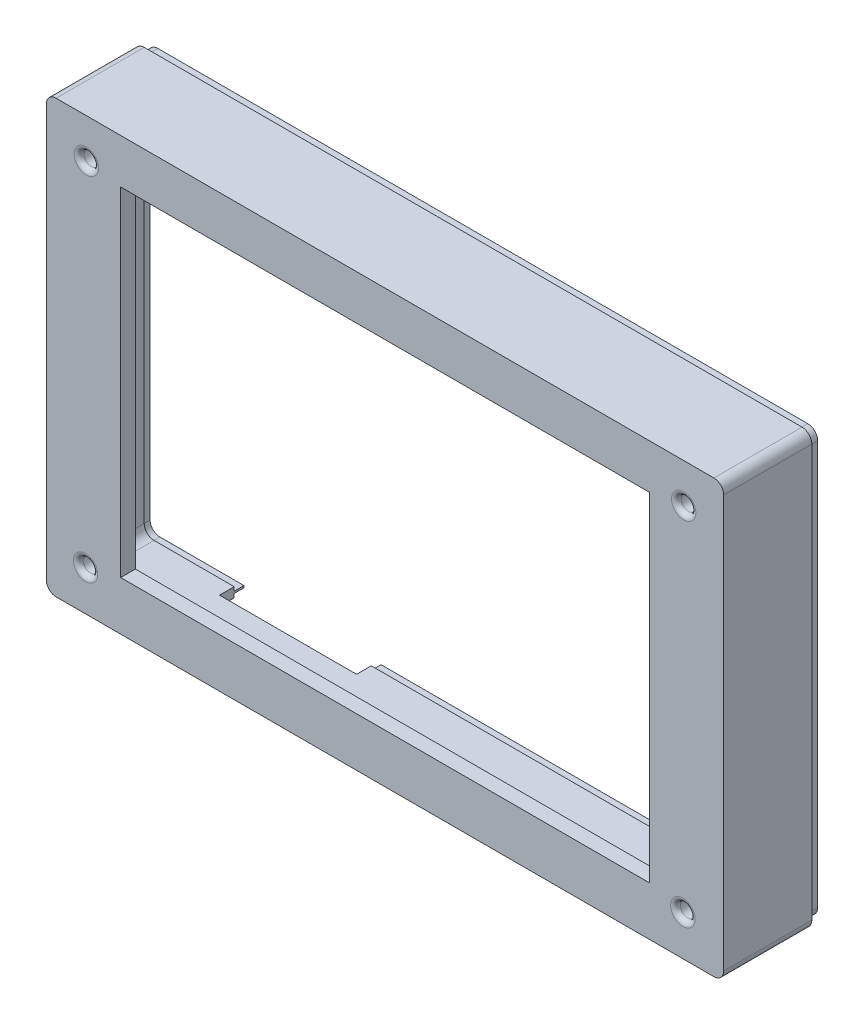
from build123d import *

# Parameters (mm, degrees)
SZKIC2_W                          = 138.377616904
SZKIC2_H                          = 88.232378654
SZKIC2_R                          = 1.492872888
SZKIC2_R_2                        = 1.482348965
SZKIC2_R_3                        = 1.507070184
SZKIC2_W_2                        = 108
SZKIC2_H_2                        = 69.098765565
DODANIE_WYCI_GNI_CIE1_DEPTH       = 3
SZKIC3_W                          = 138.377616904
SZKIC3_H                          = 88.232378654
SZKIC3_W_2                        = 134.377616904
SZKIC3_H_2                        = 84.232378654
WYCI_GNI_CIE_CIENKA_CIANKA1_DEPTH = 15
ZAOKR_GLENIE1_R                   = 1
DODANIE_WYCI_GNI_CIE2_START       = 1
SZKIC4_R                          = 2.492872888
SZKIC4_R_2                        = 1.492872888
SZKIC4_R_3                        = 2.507070184
SZKIC4_R_4                        = 1.507070184
SZKIC4_R_5                        = 2.482348965
SZKIC4_R_6                        = 1.482348965
DODANIE_WYCI_GNI_CIE2_DEPTH       = 1
ZAOKR_GLENIE2_R                   = 1
SZKIC5_W                          = 136.777616904
SZKIC5_H                          = 86.632378654
SZKIC5_W_2                        = 135.977616904
SZKIC5_H_2                        = 85.832378654
WYCI_GNI_CIE_CIENKA_CIANKA2_DEPTH = 2
ZAOKR_GLENIE3_R                   = 2
WYTNIJ_WYCI_GNI_CIE1_START        = 12
SZKIC6_W                          = 28
SZKIC6_H                          = 7.331859192
WYTNIJ_WYCI_GNI_CIE1_DEPTH        = 439.2299015


with BuildPart() as part:
    # Szkic2 → Dodanie-wyciągnięcie1 (new body)
    with BuildSketch(Plane.XY):
        with Locations((-255.799797678, 267.011389153)):
            Rectangle(SZKIC2_W, SZKIC2_H)
        with Locations((-316.814669774, 303.115988479)):
            Circle(SZKIC2_R, mode=Mode.SUBTRACT)
        with Locations((-316.977118633, 231.115988479)):
            Circle(SZKIC2_R_2, mode=Mode.SUBTRACT)
        with Locations((-194.947118633, 231.115988479)):
            Circle(SZKIC2_R_3, mode=Mode.SUBTRACT)
        with Locations((-194.784669774, 303.115988479)):
            Circle(SZKIC2_R, mode=Mode.SUBTRACT)
        with Locations((-255.799669774, 267.462127396)):
            Rectangle(SZKIC2_W_2, SZKIC2_H_2, mode=Mode.SUBTRACT)
    extrude(amount=DODANIE_WYCI_GNI_CIE1_DEPTH)

    # Szkic3 → Wyciągnięcie-cienka ścianka1 (add)
    with BuildSketch(Plane(origin=(0, 0, 0), x_dir=(-1, 0, 0), z_dir=(0, 0, -1))):
        with Locations((255.799797678, 267.011389153)):
            Rectangle(SZKIC3_W, SZKIC3_H)
        with Locations((255.799797678, 267.011389153)):
            Rectangle(SZKIC3_W_2, SZKIC3_H_2, mode=Mode.SUBTRACT)
    extrude(amount=WYCI_GNI_CIE_CIENKA_CIANKA1_DEPTH)

    # Zaokrąglenie1
    zaokr_glenie1_edges = [part.edges().sort_by_distance(p)[0] for p in [
        (-318.307542662, 303.115988479, 3),
        (-318.459467597, 231.115988479, 3),
        (-196.454188817, 231.115988479, 3),
        (-196.277542662, 303.115988479, 3),
    ]]
    fillet(zaokr_glenie1_edges, radius=ZAOKR_GLENIE1_R)

    # Szkic4 → Dodanie-wyciągnięcie2 (add)
    # profile 1 of 4: a face of its own
    with BuildSketch(Plane(origin=(0, 0, 0), x_dir=(-1, 0, 0), z_dir=(0, 0, -1)).offset(DODANIE_WYCI_GNI_CIE2_START)):
        with Locations(Location((194.784669774, 303.115988479, 0), (0, 0, 180))):
            Circle(SZKIC4_R)
        with Locations((194.784669774, 303.115988479)):
            Circle(SZKIC4_R_2, mode=Mode.SUBTRACT)
    # profile 2 of 4: a face of its own
    with BuildSketch(Plane(origin=(0, 0, 0), x_dir=(-1, 0, 0), z_dir=(0, 0, -1)).offset(DODANIE_WYCI_GNI_CIE2_START)):
        with Locations(Location((194.947118633, 231.115988479, 0), (0, 0, 180))):
            Circle(SZKIC4_R_3)
        with Locations((194.947118633, 231.115988479)):
            Circle(SZKIC4_R_4, mode=Mode.SUBTRACT)
    # profile 3 of 4: a face of its own
    with BuildSketch(Plane(origin=(0, 0, 0), x_dir=(-1, 0, 0), z_dir=(0, 0, -1)).offset(DODANIE_WYCI_GNI_CIE2_START)):
        with Locations(Location((316.977118633, 231.115988479, 0), (0, 0, 180))):
            Circle(SZKIC4_R_5)
        with Locations((316.977118633, 231.115988479)):
            Circle(SZKIC4_R_6, mode=Mode.SUBTRACT)
    # profile 4 of 4: a face of its own
    with BuildSketch(Plane(origin=(0, 0, 0), x_dir=(-1, 0, 0), z_dir=(0, 0, -1)).offset(DODANIE_WYCI_GNI_CIE2_START)):
        with Locations(Location((316.814669774, 303.115988479, 0), (0, 0, 180))):
            Circle(SZKIC4_R)
        with Locations((316.814669774, 303.115988479)):
            Circle(SZKIC4_R_2, mode=Mode.SUBTRACT)
    extrude(amount=-DODANIE_WYCI_GNI_CIE2_DEPTH)

    # Zaokrąglenie2
    zaokr_glenie2_edges = [part.edges().sort_by_distance(p)[0] for p in [
        (-197.277542662, 303.115988479, 0),
        (-197.454188817, 231.115988479, 0),
        (-319.459467597, 231.115988479, 0),
        (-319.307542662, 303.115988479, 0),
    ]]
    fillet(zaokr_glenie2_edges, radius=ZAOKR_GLENIE2_R - 0.0001)  # a hair under: the kernel refuses the full size

    # Szkic5 → Wyciągnięcie-cienka ścianka2 (add)
    with BuildSketch(Plane(origin=(0, 0, -15), x_dir=(-1, 0, 0), z_dir=(0, 0, -1))):
        with Locations((255.799797678, 267.011389153)):
            Rectangle(SZKIC5_W, SZKIC5_H)
        with Locations((255.799797678, 267.011389153)):
            Rectangle(SZKIC5_W_2, SZKIC5_H_2, mode=Mode.SUBTRACT)
    extrude(amount=WYCI_GNI_CIE_CIENKA_CIANKA2_DEPTH)

    # Zaokrąglenie3
    zaokr_glenie3_edges = [part.edges().sort_by_distance(p)[0] for p in [
        (-187.410989226, 310.32757848, -16),
        (-187.410989226, 223.695199826, -16),
        (-324.18860613, 223.695199826, -16),
        (-324.18860613, 310.32757848, -16),
        (-187.810989226, 224.095199826, -16),
        (-323.78860613, 224.095199826, -16),
        (-323.78860613, 309.92757848, -16),
        (-187.810989226, 309.92757848, -16),
        (-186.610989226, 222.895199826, -6),
        (-324.98860613, 222.895199826, -6),
        (-324.98860613, 311.12757848, -6),
        (-186.610989226, 311.12757848, -6),
        (-188.610989226, 224.895199826, -7.5),
        (-322.98860613, 224.895199826, -7.5),
        (-322.98860613, 309.12757848, -7.5),
        (-188.610989226, 309.12757848, -7.5),
    ]]
    fillet(zaokr_glenie3_edges, radius=ZAOKR_GLENIE3_R)

    # Szkic6 → Wytnij-wyciągnięcie1 (cut, through all)
    with BuildSketch(Plane(origin=(0, 0, 0), x_dir=(-1, 0, 0), z_dir=(0, 0, -1)).offset(WYTNIJ_WYCI_GNI_CIE1_START)):
        with Locations((290.610989226, 221.246815017)):
            Rectangle(SZKIC6_W, SZKIC6_H)
    extrude(amount=WYTNIJ_WYCI_GNI_CIE1_DEPTH, mode=Mode.SUBTRACT)


solid = part.part
